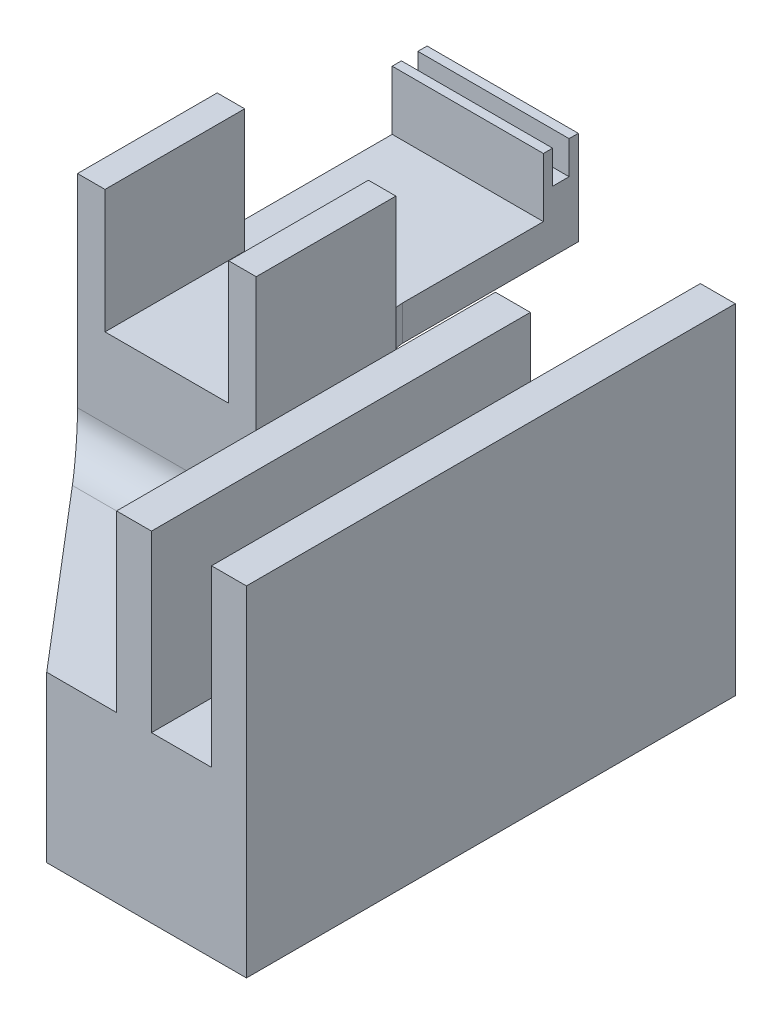
from build123d import *

# Parameters (mm, degrees)
BOSS_EXTRUDE1_DEPTH             = 12.7
BOSS_EXTRUDE2_REACH             = 70.956
BOSS_EXTRUDE2_DIRECTION_2_REACH = 70.956
SKETCH5_W                       = 27.5
SKETCH5_H                       = 3
CUT_EXTRUDE1_DEPTH              = 6
FILLET2_R                       = 6.35
FILLET3_START                   = -16.25
FILLET3_DEPTH                   = 32.5
FILLET3_START_2                 = -29
FILLET3_2_DEPTH                 = 7.65
BOSS_EXTRUDE3_DEPTH             = 38.1
BOSS_EXTRUDE3_DEPTH_BACK        = 50.8
CUT_EXTRUDE2_REACH              = 96.662
SKETCH7_W                       = 20
SKETCH7_H                       = 31.75
FILLET4_R                       = 12.7
BOSS_EXTRUDE4_DEPTH             = 30
FILLET6_R                       = 6.35


with BuildPart() as part:
    # Sketch2 → Boss-Extrude1 (new, symmetric)
    with BuildSketch(Plane.XY):
        Polygon((-11.25, 7.44), (-11.25, -15), (11.25, -15), (11.25, 7.44), (16.25, 7.44), (16.25, -65.8), (-16.25, -65.8), (-16.25, 7.44), align=None)
    extrude(amount=BOSS_EXTRUDE1_DEPTH, both=True)

    # Boss-Extrude2: up to this face of the body (flat: up to its plane)
    boss_extrude2_end = Plane(part.part.faces().sort_by_distance((11.25, -3.78, 0))[0])
    # Sketch4 → Boss-Extrude2 (add, up to the picked face)
    with BuildSketch(Plane(origin=(0, 0, 0), x_dir=(0, 0, -1), z_dir=(1, 0, 0)), mode=Mode.PRIVATE) as boss_extrude2_sk1:
        Polygon((12.7, -15), (44.525, -15), (44.525, -4.262817999), (50.875, -4.262817999), (50.875, -21.35), (12.7, -21.35), align=None)
    boss_extrude2_tool1 = split(extrude(boss_extrude2_sk1.sketch, amount=BOSS_EXTRUDE2_REACH, mode=Mode.PRIVATE), bisect_by=boss_extrude2_end, keep=Keep.BOTH, mode=Mode.PRIVATE)
    add(boss_extrude2_tool1.solids().sort_by(Axis((0, -16.299514, -35.280605), (1, 0, 0)))[0])

    # Boss-Extrude2 direction 2: up to this face of the body (flat: up to its plane)
    boss_extrude2_direction_2_end = Plane(part.part.faces().sort_by_distance((-16.25, -29.18, 0))[0])
    # Sketch4 → Boss-Extrude2 direction 2 (add, up to the picked face)
    with BuildSketch(Plane(origin=(0, 0, 0), x_dir=(0, 0, -1), z_dir=(1, 0, 0)), mode=Mode.PRIVATE) as boss_extrude2_direction_2_sk1:
        Polygon((12.7, -15), (44.525, -15), (44.525, -4.262817999), (50.875, -4.262817999), (50.875, -21.35), (12.7, -21.35), align=None)
    boss_extrude2_direction_2_tool1 = split(extrude(boss_extrude2_direction_2_sk1.sketch, amount=-BOSS_EXTRUDE2_DIRECTION_2_REACH, mode=Mode.PRIVATE), bisect_by=boss_extrude2_direction_2_end, keep=Keep.BOTH, mode=Mode.PRIVATE)
    add(boss_extrude2_direction_2_tool1.solids().sort_by(Axis((0, -16.299514, -35.280605), (-1, 0, 0)))[0])

    # Sketch5 → Cut-Extrude1 (cut)
    with BuildSketch(Plane(origin=(0, -4.262817999, 0), x_dir=(1, 0, 0), z_dir=(0, 1, 0))):
        with Locations((-2.5, 47.7)):
            Rectangle(SKETCH5_W, SKETCH5_H)
    extrude(amount=-CUT_EXTRUDE1_DEPTH, mode=Mode.SUBTRACT)

    # Fillet2
    # the kernel refuses this fillet: 6.35 mm, written as the material it adds along each edge
    with BuildSketch(Plane(origin=(11.25, -15, -12.7), x_dir=(0, 0, -1), z_dir=(0, -1, 0))) as fillet2_piece_1:
        with BuildLine():
            CenterArc((6.204836823, 6.35), FILLET2_R, 192.274670215, 77.725329785)
            Line((0, 5), (0, 0))
            Line((0, 0), (6.204836823, 0))
        make_face()
    extrude(amount=6.35)

    # Fillet3: read off the stored shape, not the designer's step
    # Fillet3 outline → Fillet3 (add)
    with BuildSketch(Plane.YZ.offset(FILLET3_START)):
        with BuildLine():
            Line((-21.35, -12.7), (-27.7, -12.7))
            ThreePointArc((-27.7, -12.7), (-23.209871939, -14.559871939), (-21.35, -19.05))
            Line((-21.35, -19.05), (-21.35, -12.7))
        make_face()
    extrude(amount=FILLET3_DEPTH)

    # Fillet3 2 outline → Fillet3 2 (cut)
    with BuildSketch(Plane(origin=(0, 0, 0), x_dir=(1, 0, 0), z_dir=(0, 1, 0)).offset(FILLET3_START_2)):
        with BuildLine():
            Line((11.25, 21), (11.25, 18.904836823))
            ThreePointArc((11.25, 18.904836823), (12.655571335, 14.920476752), (16.250039425, 12.699991422))
            Line((16.250039425, 12.699991422), (18, 12.319260294))
            Line((18, 12.319260294), (18, 21))
            Line((18, 21), (11.25, 21))
        make_face()
    extrude(amount=FILLET3_2_DEPTH, mode=Mode.SUBTRACT)

    # Sketch6 → Boss-Extrude3 (add, two sides: drawn at the far end of the back side and taken through both)
    with BuildSketch(Plane.XY.offset(12.7).offset(-BOSS_EXTRUDE3_DEPTH_BACK)):
        Polygon((16.25, -65.8), (52.572, -65.8), (52.572, -4.05), (46.222, -4.05), (46.222, -35.8), (35.3, -35.8), (35.3, -4.05), (28.95, -4.05), (28.95, -35.8), (16.25, -35.8), align=None)
    extrude(amount=BOSS_EXTRUDE3_DEPTH + BOSS_EXTRUDE3_DEPTH_BACK)

    # Sketch7 → Cut-Extrude2 (cut, up to next)
    with BuildSketch(Plane.ZY.offset(-28.95), mode=Mode.PRIVATE) as cut_extrude2_sk1:
        with Locations((-28.1, -19.925)):
            Rectangle(SKETCH7_W, SKETCH7_H)
    cut_extrude2_tool1 = extrude(cut_extrude2_sk1.sketch, amount=-CUT_EXTRUDE2_REACH, mode=Mode.PRIVATE) & part.part
    add(cut_extrude2_tool1.solids().sort_by_distance((28.95, -19.925, -28.1))[0], mode=Mode.SUBTRACT)

    # Fillet4
    fillet4_edges = [part.edges().sort_by_distance(p)[0] for p in [
        (16.25, -50.8, -12.7),
    ]]
    fillet(fillet4_edges, radius=FILLET4_R)

    # Sketch8 → Boss-Extrude4 (add)
    with BuildSketch(Plane.XZ.offset(65.8)):
        Polygon((-16.25, 12.7), (16.25, 50.8), (16.25, 12.7), align=None)
    extrude(amount=-BOSS_EXTRUDE4_DEPTH)

    # Fillet6
    fillet6_edges = [part.edges().sort_by_distance(p)[0] for p in [
        (0, -35.8, 12.7),
    ]]
    fillet(fillet6_edges, radius=FILLET6_R)


solid = part.part
